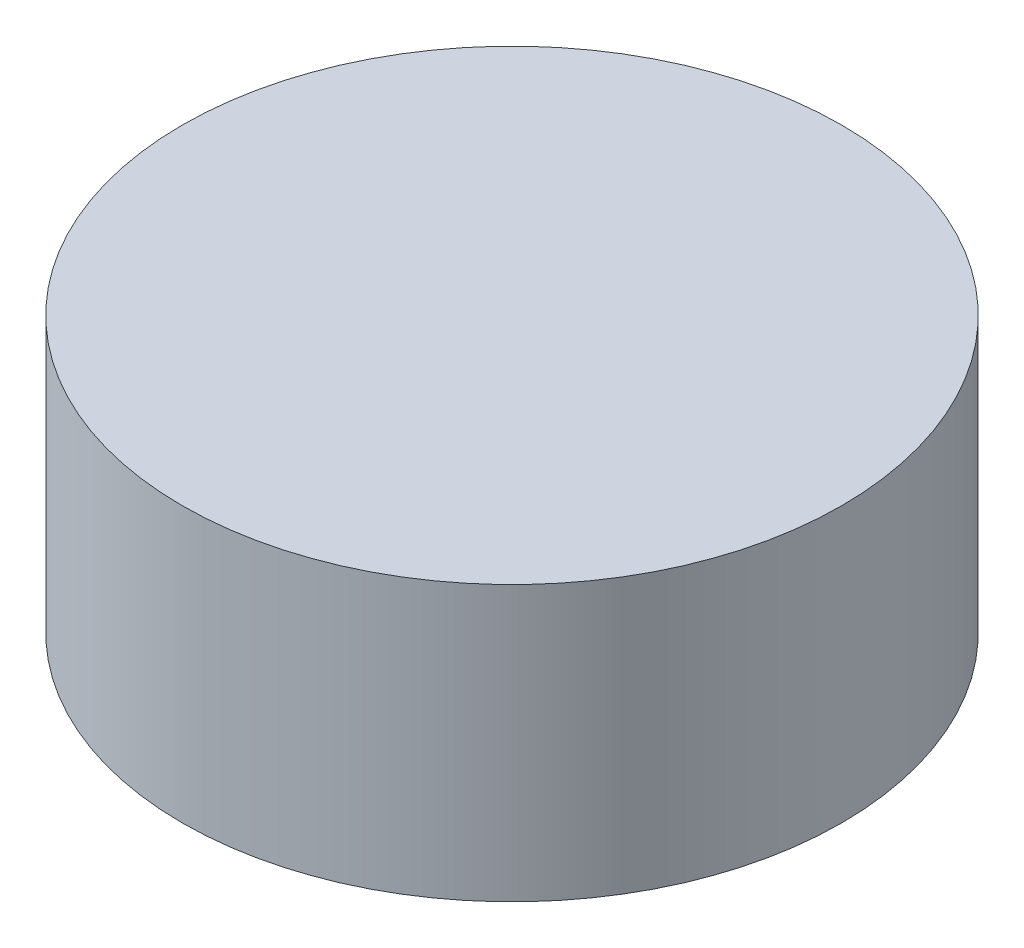
from build123d import *

# Parameters (mm, degrees)
SKETCH1_R      = 3
EXTRUDE1_DEPTH = 2.5


with BuildPart() as part:
    # Sketch1 → Extrude1 (new body)
    with BuildSketch(Plane(origin=(0, 0, 0), x_dir=(1, 0, 0), z_dir=(0, 1, 0))):
        Circle(SKETCH1_R)
    extrude(amount=EXTRUDE1_DEPTH)


solid = part.part
